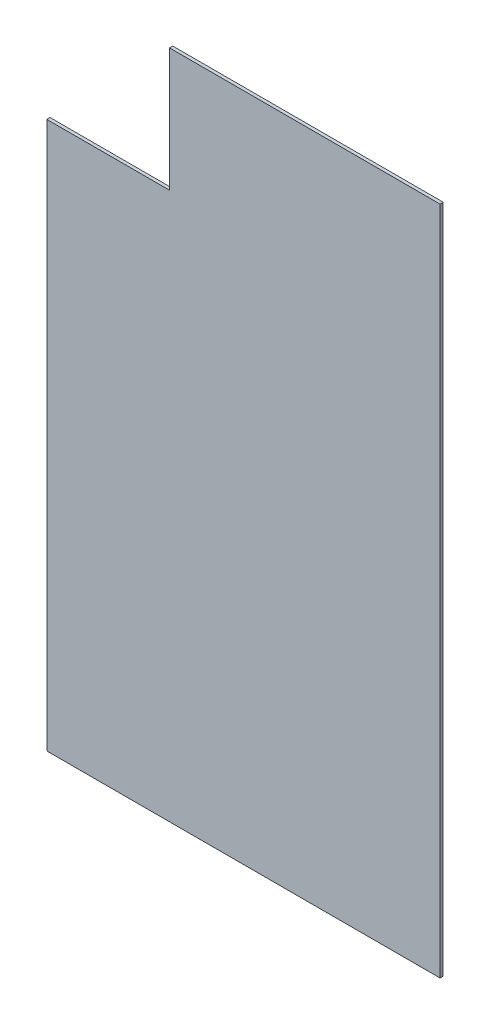
from build123d import *

# Parameters (mm, degrees)
TABAN_FLAN_1_DEPTH = 12


# Sheet-metal steps are written as plain solids
with BuildPart() as part:
    # Çizim1 → Taban-Flanş1 (new body)
    with BuildSketch(Plane.XY):
        Polygon((0, 0), (0, 2050), (460, 2050), (460, 2512), (1474, 2512), (1474, 0), align=None)
    extrude(amount=-TABAN_FLAN_1_DEPTH)


solid = part.part
